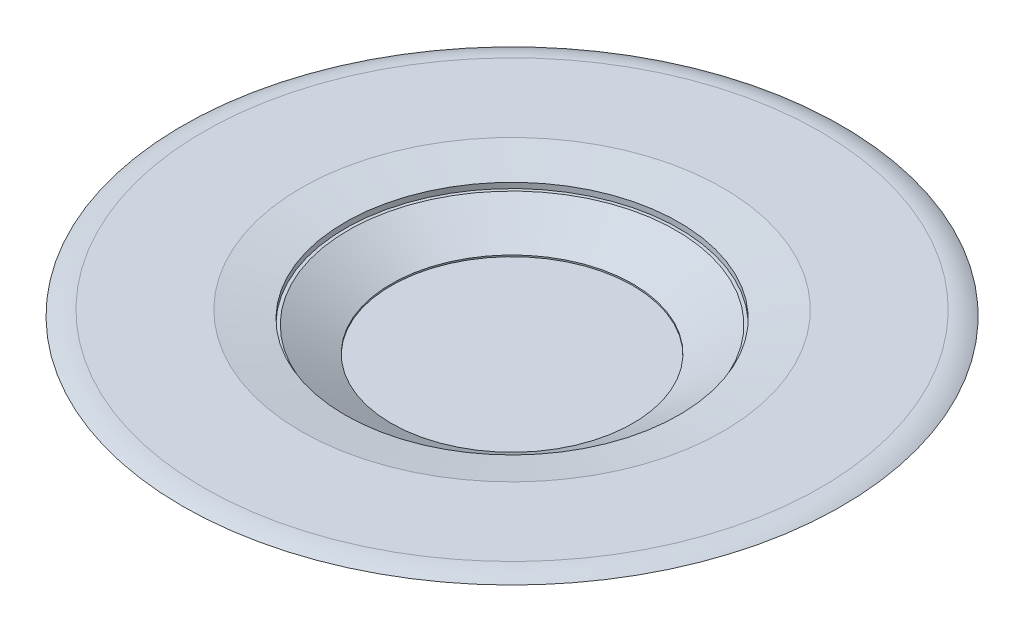
from build123d import *

# Parameters (mm, degrees)
SKETCH1_R           = 41.369507048
BOSS_EXTRUDE1_DEPTH = 15
SKETCH3_R           = 27.5
CUT_EXTRUDE1_DEPTH  = 9
SKETCH4_R           = 41.369507048
CUT_EXTRUDE2_DEPTH  = 5
SKETCH5_R           = 53.188342474
BOSS_EXTRUDE2_DEPTH = 2
SKETCH6_R           = 40
CUT_EXTRUDE8_DEPTH  = 2
FILLET1_R           = 10
FILLET3_R           = 5
SKETCH7_R           = 75
BOSS_EXTRUDE3_DEPTH = 3
SKETCH8_R           = 38
CUT_EXTRUDE11_DEPTH = 3
CHAMFER4_SIZE       = 10
CHAMFER4_SIZE2      = 1.763269807
CHAMFER5_SIZE       = 10
CHAMFER5_SIZE2      = 1.763269807
FILLET5_R           = 10
SKETCH10_R          = 37.303847577
BOSS_EXTRUDE4_DEPTH = 5
CHAMFER6_SIZE       = 10
CHAMFER6_SIZE2      = 1.763269807
FILLET6_R           = 2


with BuildPart() as part:
    # Sketch1 → Boss-Extrude1 (new body)
    with BuildSketch(Plane(origin=(0, 0, 0), x_dir=(1, 0, 0), z_dir=(0, 1, 0))):
        with Locations(Location((0, 0, 0), (0, 0, 270))):
            Circle(SKETCH1_R)
    extrude(amount=BOSS_EXTRUDE1_DEPTH)

    # Sketch3 → Cut-Extrude1 (cut)
    with BuildSketch(Plane(origin=(0, 15, 0), x_dir=(1, 0, 0), z_dir=(0, 1, 0))):
        with Locations(Location((0, 0, 0), (0, 0, 270))):
            Circle(SKETCH3_R)
    extrude(amount=-CUT_EXTRUDE1_DEPTH, mode=Mode.SUBTRACT)

    # Sketch4 → Cut-Extrude2 (cut)
    with BuildSketch(Plane(origin=(0, 0, 0), x_dir=(1, 0, 0), z_dir=(0, 1, 0))):
        with Locations(Location((0, 0, 0), (0, 0, 270))):
            Circle(SKETCH4_R)
    extrude(amount=CUT_EXTRUDE2_DEPTH, mode=Mode.SUBTRACT)

    # Chamfer2: read off the stored shape, not the designer's step
    # Chamfer2 outline → Chamfer2 (revolve, cut)
    with BuildSketch(Plane.XY):
        Polygon((26.369507048, 5), (41.369507048, 5), (41.369507048, 13.660254038), align=None)
        Polygon((27.5, 6.339745962), (41.369507048, 14.34730959), (41.369507048, 15), (27.5, 15), align=None)
    revolve(axis=Axis((0, 0, 0), (0, 1, 0)), mode=Mode.SUBTRACT)

    # Sketch5 → Boss-Extrude2 (add)
    with BuildSketch(Plane(origin=(0, 15, 0), x_dir=(1, 0, 0), z_dir=(0, 1, 0))):
        with Locations(Location((0, 0, 0), (0, 0, 270))):
            Circle(SKETCH5_R)
    extrude(amount=-BOSS_EXTRUDE2_DEPTH)

    # Sketch6 → Cut-Extrude8 (cut)
    with BuildSketch(Plane(origin=(0, 15, 0), x_dir=(1, 0, 0), z_dir=(0, 1, 0))):
        with Locations(Location((0, 0, 0), (0, 0, 270))):
            Circle(SKETCH6_R)
    extrude(amount=-CUT_EXTRUDE8_DEPTH, mode=Mode.SUBTRACT)

    # Fillet1
    # the kernel refuses this fillet: 10 mm, written as the material it takes off along each edge
    with BuildSketch(Plane(origin=(0, 15, 0), x_dir=(0, 0, 1), z_dir=(-1, 0, 0))) as fillet1_piece_1:
        with BuildLine():
            CenterArc((46, -10), FILLET1_R, 90, 36.869897646)
            Line((40, -2), (39.88, -1.84))
            ThreePointArc((39.88, -1.84), (39.8, -1), (39.8, 0))
            Line((39.8, 0), (40, 0.2))
            Line((40, 0.2), (46, 0.2))
            Line((46, 0.2), (46, 0))
        make_face()
    revolve(axis=Axis((0, 15, 0), (0, 1, 0)), mode=Mode.SUBTRACT)

    # Fillet3
    # the kernel refuses this fillet: 5 mm, written as the material it takes off along each edge
    with BuildSketch(Plane(origin=(0, 15, 0), x_dir=(0, 0, 1), z_dir=(-1, 0, 0))) as fillet3_piece_1:
        with BuildLine():
            CenterArc((49.188342474, -5), FILLET3_R, 36.869897646, 53.130102354)
            Line((49.188342474, 0), (49.188342474, 0.1))
            Line((49.188342474, 0.1), (53.188342474, 0.1))
            Line((53.188342474, 0.1), (53.288342474, 0))
            ThreePointArc((53.288342474, 0), (53.288342474, -1), (53.268342474, -1.94))
            Line((53.268342474, -1.94), (53.188342474, -2))
        make_face()
    revolve(axis=Axis((0, 15, 0), (0, 1, 0)), mode=Mode.SUBTRACT)

    # Sketch7 → Boss-Extrude3 (add)
    with BuildSketch(Plane(origin=(0, 15, 0), x_dir=(1, 0, 0), z_dir=(0, 1, 0))):
        with Locations(Location((0, 0, 0), (0, 0, 270))):
            Circle(SKETCH7_R)
    extrude(amount=-BOSS_EXTRUDE3_DEPTH)

    # Sketch8 → Cut-Extrude11 (cut)
    with BuildSketch(Plane(origin=(0, 15, 0), x_dir=(1, 0, 0), z_dir=(0, 1, 0))):
        with Locations(Location((0, 0, 0), (0, 0, 270))):
            Circle(SKETCH8_R)
    extrude(amount=-CUT_EXTRUDE11_DEPTH, mode=Mode.SUBTRACT)

    # Chamfer4
    chamfer4_edges = [part.edges().sort_by_distance(p)[0] for p in [
        (0, 15, -38),
    ]]
    chamfer4_side = [part.faces().sort_by_distance(p)[0] for p in [
        (0, 15, -72.878679656),
    ]]
    chamfer(chamfer4_edges, length=CHAMFER4_SIZE, length2=CHAMFER4_SIZE2, reference=chamfer4_side[0])

    # Chamfer5
    chamfer5_edges = [part.edges().sort_by_distance(p)[0] for p in [
        (0, 12, -75),
    ]]
    chamfer5_side = [part.faces().sort_by_distance(p)[0] for p in [
        (0, 12, -72.878679656),
    ]]
    chamfer(chamfer5_edges, length=CHAMFER5_SIZE, length2=CHAMFER5_SIZE2, reference=chamfer5_side[0])

    # Fillet5
    # the kernel refuses this fillet: 10 mm, written as the material it takes off along each edge
    with BuildSketch(Plane(origin=(0, 15, 0), x_dir=(0, 0, 1), z_dir=(-1, 0, 0))) as fillet5_piece_1:
        with BuildLine():
            CenterArc((70.182832545, -10), FILLET5_R, 61.202414485, 28.797585515)
            Line((70.182832545, 0), (70.182832545, 0.2))
            Line((70.182832545, 0.2), (75, 0.2))
            Line((75, 0.2), (75.2, 0))
            ThreePointArc((75.2, 0), (75.2, -0.618365096), (75.096343349, -1.061464797))
            Line((75.096343349, -1.061464797), (75, -1.236730193))
        make_face()
    revolve(axis=Axis((0, 15, 0), (0, 1, 0)), mode=Mode.SUBTRACT)

    # Sketch10 → Boss-Extrude4 (add)
    with BuildSketch(Plane(origin=(0, 0, 0), x_dir=(1, 0, 0), z_dir=(0, 1, 0))):
        with Locations(Location((0, 0, 0), (0, 0, 270))):
            Circle(SKETCH10_R)
    extrude(amount=BOSS_EXTRUDE4_DEPTH)

    # Chamfer6
    chamfer6_edges = [part.edges().sort_by_distance(p)[0] for p in [
        (0, 0, -37.303847577),
    ]]
    chamfer6_side = [part.faces().sort_by_distance(p)[0] for p in [
        (0, 0, 0),
    ]]
    chamfer(chamfer6_edges, length=CHAMFER6_SIZE, length2=CHAMFER6_SIZE2, reference=chamfer6_side[0])

    # Fillet6
    fillet6_edges = [part.edges().sort_by_distance(p)[0] for p in [
        (0, 5, -37.303847577),
    ]]
    fillet(fillet6_edges, radius=FILLET6_R)


solid = part.part
